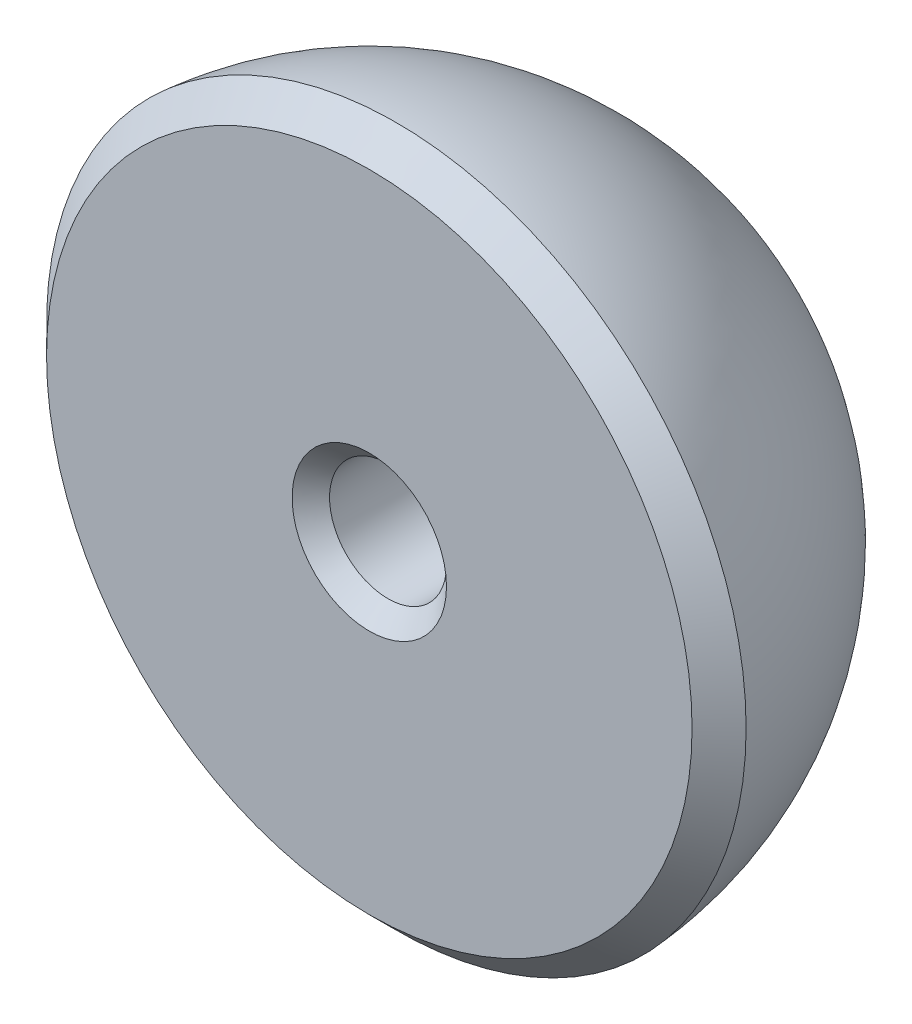
from build123d import *

# Parameters (mm, degrees)
SKETCH4_R          = 2.38125
CUT_EXTRUDE2_DEPTH = 6.35
FILLET1_R          = 0.396875
CHAMFER1_SIZE      = 0.762


with BuildPart() as part:
    # Sketch1 → Revolve1 (revolve)
    with BuildSketch(Plane(origin=(0, 0, 0), x_dir=(1, 0, 0), z_dir=(0, 1, 0))):
        with BuildLine():
            Line((1.5875, 0), (9.525, 0))
            ThreePointArc((9.525, 0), (7.274838916, 6.148361062), (1.5875, 9.391776656))
            Line((1.5875, 9.391776656), (1.5875, 0))
        make_face()
    revolve(axis=Axis((0, 0, 0), (0, 0, -1)))

    # Sketch4 → Cut-Extrude2 (cut)
    with BuildSketch(Plane(origin=(0, 0, -9.525), x_dir=(-1, 0, 0), z_dir=(0, 0, -1))):
        Circle(SKETCH4_R)
    extrude(amount=-CUT_EXTRUDE2_DEPTH, mode=Mode.SUBTRACT)

    # Fillet1
    fillet1_edges = [part.edges().sort_by_distance(p)[0] for p in [
        (2.38125, 0, -3.175),
    ]]
    fillet(fillet1_edges, radius=FILLET1_R)

    # Chamfer1
    # the kernel refuses this chamfer: 0.762 mm, written as the material it takes off along each edge
    with BuildSketch(Plane(origin=(0, 0, 0), x_dir=(1, 0, 0), z_dir=(0, 1, 0))) as chamfer1_piece_1:
        with BuildLine():
            Line((9.525 - CHAMFER1_SIZE, 0), (9.496699923, 0.733699923))
            ThreePointArc((9.496699923, 0.733699923), (9.517517871, 0.37746333), (9.525, 0))
            Line((9.525, 0), (9.525 - CHAMFER1_SIZE, 0))
        make_face()
    revolve(axis=Axis((0, 0, 0), (0, 0, -1)), mode=Mode.SUBTRACT)

    # Chamfer2: read off the stored shape, not the designer's step
    # Chamfer2 outline → Chamfer2 (revolve, cut)
    with BuildSketch(Plane.XZ):
        Polygon((2.033114035, -3.178004117), (1.5875, -2.673849388), (1.5875, -3.178004117), align=None)
        Polygon((1.5875, 0), (1.5875, -0.508), (2.0955, 0), align=None)
        Polygon((2.857431183, -9.086292535), (2.38125, -8.805548582), (2.38125, -9.086292535), align=None)
    revolve(axis=Axis((0, 0, 0), (0, 0, 1)), mode=Mode.SUBTRACT)

    # Chamfer2 2 outline → Chamfer2 2 (revolve, cut)
    with BuildSketch(Plane.XZ):
        with BuildLine():
            Line((2.857431193, -9.086292532), (2.38125, -9.086292535))
            Line((2.38125, -9.086292535), (2.381249991, -9.222541596))
            ThreePointArc((2.381249991, -9.222541596), (2.620226343, -9.157512703), (2.857431193, -9.086292532))
        make_face()
    revolve(axis=Axis((0, 0, 0), (0, 0, 1)), mode=Mode.SUBTRACT)


solid = part.part
